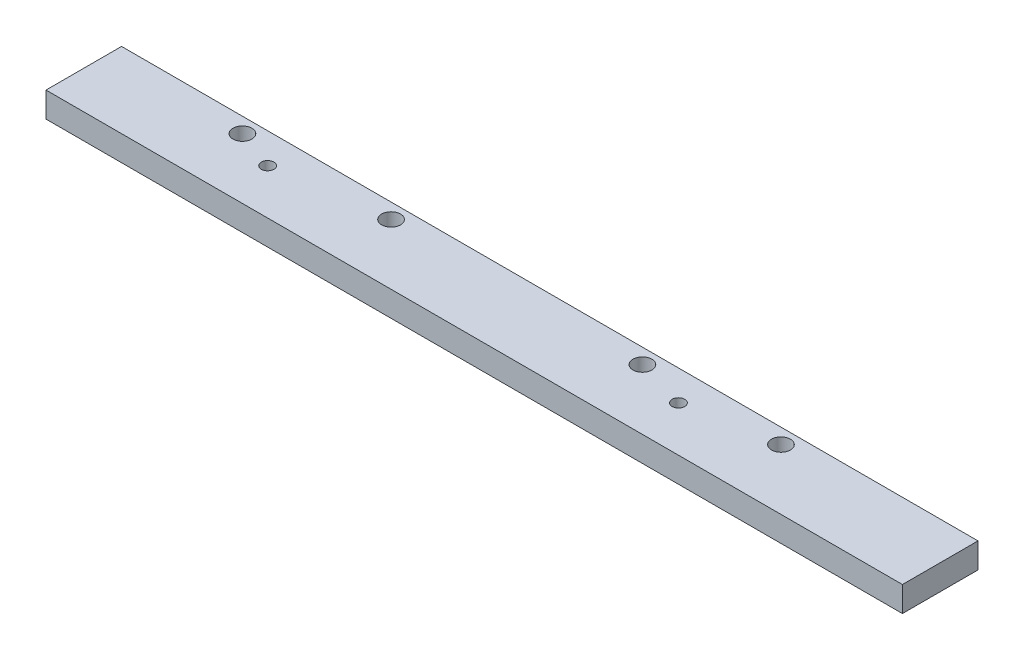
from build123d import *

# Parameters (mm, degrees)
SKETCH1_W           = 431.8
SKETCH1_H           = 38.1
SKETCH1_R           = 4.7625
SKETCH1_R_2         = 3.175
BOSS_EXTRUDE1_DEPTH = 12.7


with BuildPart() as part:
    # Sketch1 → Boss-Extrude1 (new body)
    with BuildSketch(Plane(origin=(0, 0, 0), x_dir=(1, 0, 0), z_dir=(0, 1, 0))):
        with Locations((215.9, 19.05)):
            Rectangle(SKETCH1_W, SKETCH1_H)
        with Locations((68.559149034, 30.48)):
            Circle(SKETCH1_R, mode=Mode.SUBTRACT)
        with Locations((143.489149034, 30.48)):
            Circle(SKETCH1_R, mode=Mode.SUBTRACT)
        with Locations((270.227529034, 30.48)):
            Circle(SKETCH1_R, mode=Mode.SUBTRACT)
        with Locations((340.077529034, 30.48)):
            Circle(SKETCH1_R, mode=Mode.SUBTRACT)
        with Locations((88.9, 22.83757688)):
            Circle(SKETCH1_R_2, mode=Mode.SUBTRACT)
        with Locations((296.037, 22.83757688)):
            Circle(SKETCH1_R_2, mode=Mode.SUBTRACT)
    extrude(amount=BOSS_EXTRUDE1_DEPTH)


solid = part.part
